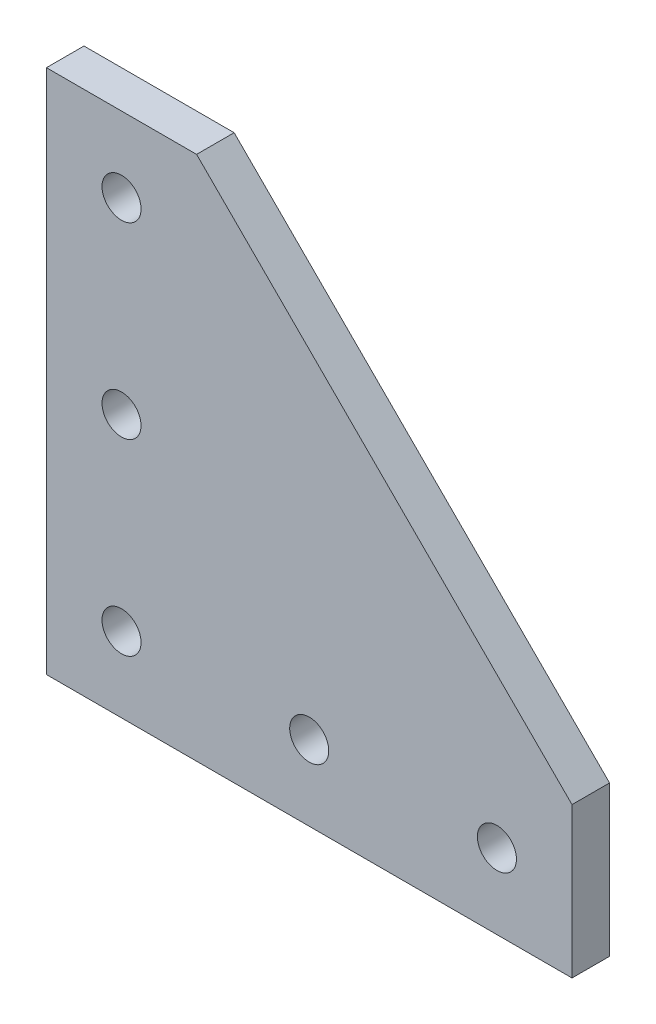
from build123d import *

# Parameters (mm, degrees)
SKETCH1_R           = 3.302
BOSS_EXTRUDE1_DEPTH = 6.35


with BuildPart() as part:
    # Sketch1 → Boss-Extrude1 (new body)
    with BuildSketch(Plane.XY):
        Polygon((0, 88.9), (0, 0), (88.9, 0), (88.9, 25.4), (25.4, 88.9), align=None)
        with Locations((12.7, 12.7)):
            Circle(SKETCH1_R, mode=Mode.SUBTRACT)
        with Locations((12.7, 44.45)):
            Circle(SKETCH1_R, mode=Mode.SUBTRACT)
        with Locations((44.45, 12.7)):
            Circle(SKETCH1_R, mode=Mode.SUBTRACT)
        with Locations((76.2, 12.7)):
            Circle(SKETCH1_R, mode=Mode.SUBTRACT)
        with Locations((12.7, 76.2)):
            Circle(SKETCH1_R, mode=Mode.SUBTRACT)
    extrude(amount=BOSS_EXTRUDE1_DEPTH)


solid = part.part
